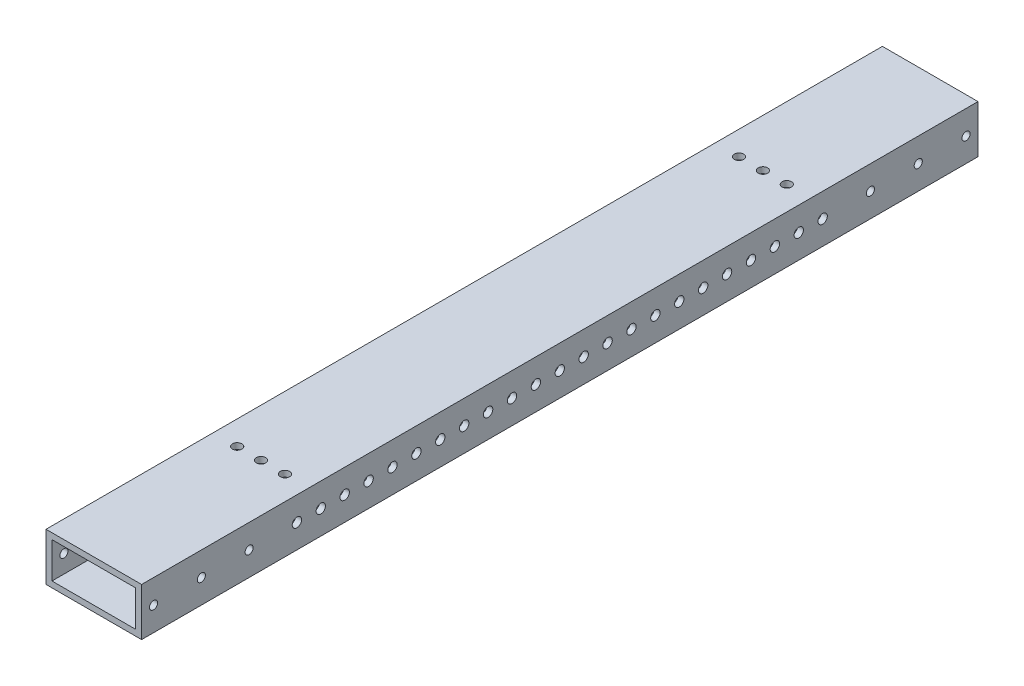
from build123d import *

# Parameters (mm, degrees)
SKETCH1_W           = 50.8
SKETCH1_H           = 25.4
SKETCH1_W_2         = 44.45
SKETCH1_H_2         = 19.05
BOSS_EXTRUDE1_DEPTH = 222.25
SKETCH3_R           = 2.15265
SKETCH3_R_2         = 2.159
CUT_EXTRUDE2_DEPTH  = 229.335263374
SKETCH4_R           = 2.4892
CUT_EXTRUDE3_DEPTH  = 229.335263374
SKETCH5_R           = 2.4892
CUT_EXTRUDE4_DEPTH  = 226.134143346


with BuildPart() as part:
    # Sketch1 → Boss-Extrude1 (new, symmetric)
    with BuildSketch(Plane.XY):
        Rectangle(SKETCH1_W, SKETCH1_H)
        Rectangle(SKETCH1_W_2, SKETCH1_H_2, mode=Mode.SUBTRACT)
    extrude(amount=BOSS_EXTRUDE1_DEPTH, both=True)

    # Sketch3 → Cut-Extrude2 (cut, through all)
    with BuildSketch(Plane(origin=(25.4, 0, 0), x_dir=(0, 0, -1), z_dir=(1, 0, 0))):
        with Locations((-215.9, 0)):
            Circle(SKETCH3_R)
        with Locations((-190.5, 0)):
            Circle(SKETCH3_R)
        with Locations((-165.1, 0)):
            Circle(SKETCH3_R)
        with Locations((215.9, 0)):
            Circle(SKETCH3_R_2)
        with Locations((190.5, 0)):
            Circle(SKETCH3_R_2)
        with Locations((165.1, 0)):
            Circle(SKETCH3_R_2)
    extrude(amount=-CUT_EXTRUDE2_DEPTH, mode=Mode.SUBTRACT)

    # Sketch4 → Cut-Extrude3 (cut, through all)
    with BuildSketch(Plane(origin=(25.4, 0, 0), x_dir=(0, 0, -1), z_dir=(1, 0, 0))):
        with Locations((-139.7, 0)):
            Circle(SKETCH4_R)
        with Locations((-127, 0)):
            Circle(SKETCH4_R)
        with Locations((-114.3, 0)):
            Circle(SKETCH4_R)
        with Locations((-101.6, 0)):
            Circle(SKETCH4_R)
        with Locations((-88.9, 0)):
            Circle(SKETCH4_R)
        with Locations((-76.2, 0)):
            Circle(SKETCH4_R)
        with Locations((-63.5, 0)):
            Circle(SKETCH4_R)
        with Locations((-50.8, 0)):
            Circle(SKETCH4_R)
        with Locations((-38.1, 0)):
            Circle(SKETCH4_R)
        with Locations((-25.4, 0)):
            Circle(SKETCH4_R)
        with Locations((-12.7, 0)):
            Circle(SKETCH4_R)
        Circle(SKETCH4_R)
        with Locations((12.7, 0)):
            Circle(SKETCH4_R)
        with Locations((25.4, 0)):
            Circle(SKETCH4_R)
        with Locations((38.1, 0)):
            Circle(SKETCH4_R)
        with Locations((50.8, 0)):
            Circle(SKETCH4_R)
        with Locations((63.5, 0)):
            Circle(SKETCH4_R)
        with Locations((76.2, 0)):
            Circle(SKETCH4_R)
        with Locations((88.9, 0)):
            Circle(SKETCH4_R)
        with Locations((101.6, 0)):
            Circle(SKETCH4_R)
        with Locations((114.3, 0)):
            Circle(SKETCH4_R)
        with Locations((127, 0)):
            Circle(SKETCH4_R)
        with Locations((139.7, 0)):
            Circle(SKETCH4_R)
    extrude(amount=-CUT_EXTRUDE3_DEPTH, mode=Mode.SUBTRACT)

    # Sketch5 → Cut-Extrude4 (cut, through all)
    with BuildSketch(Plane.XZ.offset(12.7)):
        with Locations((-12.7, 133.35)):
            Circle(SKETCH5_R)
        with Locations((0, 133.35)):
            Circle(SKETCH5_R)
        with Locations((12.7, 133.35)):
            Circle(SKETCH5_R)
        with Locations((12.7, -133.35)):
            Circle(SKETCH5_R)
        with Locations((0, -133.35)):
            Circle(SKETCH5_R)
        with Locations((-12.7, -133.35)):
            Circle(SKETCH5_R)
    extrude(amount=-CUT_EXTRUDE4_DEPTH, mode=Mode.SUBTRACT)


solid = part.part
